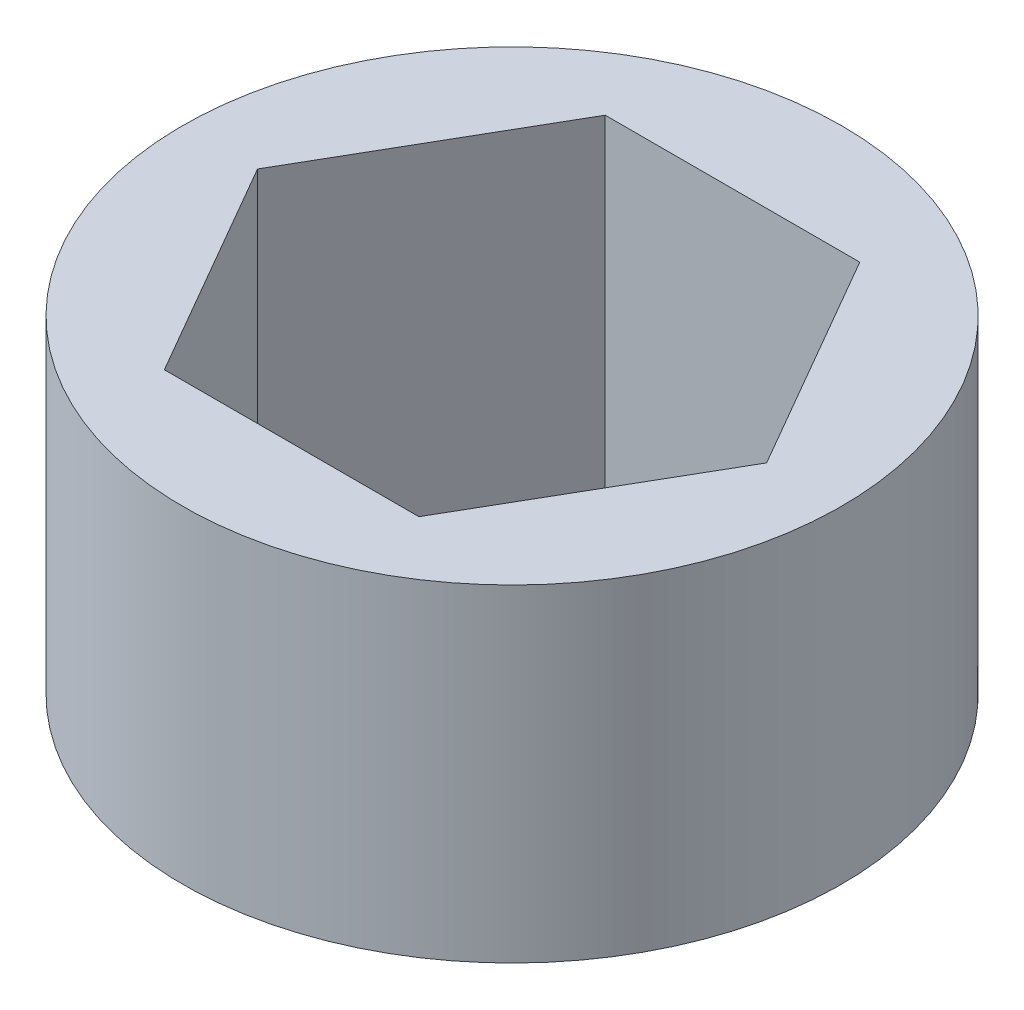
from build123d import *

# Parameters (mm, degrees)
SKETCH1_R           = 9.5885
BOSS_EXTRUDE1_DEPTH = 9.525


with BuildPart() as part:
    # Sketch1 → Boss-Extrude1 (new body)
    with BuildSketch(Plane(origin=(0, 0, 0), x_dir=(1, 0, 0), z_dir=(0, 1, 0))):
        Circle(SKETCH1_R)
        Polygon((3.702835951, 6.4135), (-3.702835951, 6.4135), (-7.405671903, 0), (-3.702835951, -6.4135), (3.702835951, -6.4135), (7.405671903, 0), align=None, mode=Mode.SUBTRACT)
    extrude(amount=BOSS_EXTRUDE1_DEPTH)


solid = part.part
